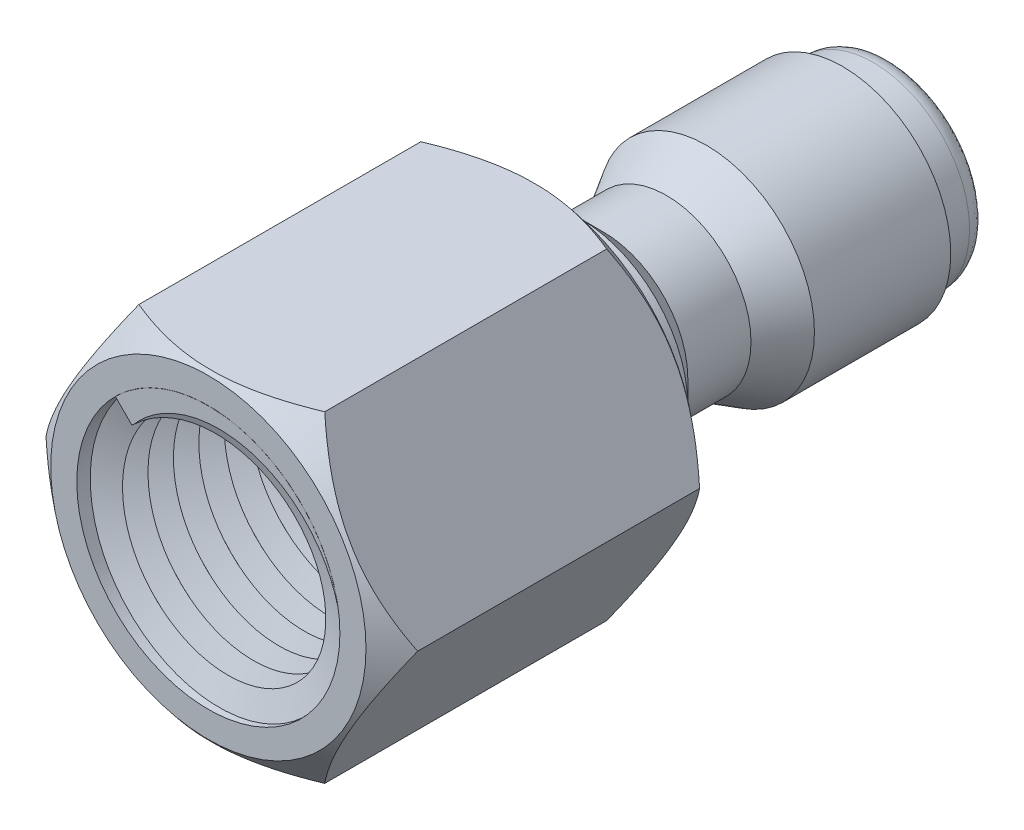
from build123d import *

# Parameters (mm, degrees)
BOSS_EXTRUDE1_DEPTH = 17.78
SKETCH2_R           = 5.842
BOSS_EXTRUDE2_DEPTH = 19.05
SKETCH4_R           = 3.175
CUT_EXTRUDE1_DEPTH  = 40.154036836
SKETCH6_R           = 7.112
CUT_EXTRUDE2_DEPTH  = 16.51
CHAMFER2_SIZE       = 2.286
SWEEP1_PITCH        = 1.375833333
FILLET2_SIZE        = 0.635
FILLET2_SIZE_2      = 0.889


with BuildPart() as part:
    # Sketch1 → Boss-Extrude1 (new body)
    with BuildSketch(Plane.XY):
        Polygon((10.045317334, 0), (5.022658667, 8.6995), (-5.022658667, 8.6995), (-10.045317334, 0), (-5.022658667, -8.6995), (5.022658667, -8.6995), align=None)
    extrude(amount=BOSS_EXTRUDE1_DEPTH)

    # Sketch2 → Boss-Extrude2 (add)
    with BuildSketch(Plane.XY):
        Circle(SKETCH2_R)
    extrude(amount=-BOSS_EXTRUDE2_DEPTH)

    # Sketch4 → Cut-Extrude1 (cut, through all)
    with BuildSketch(Plane(origin=(0, 0, -19.05), x_dir=(-1, 0, 0), z_dir=(0, 0, -1))):
        Circle(SKETCH4_R)
    extrude(amount=-CUT_EXTRUDE1_DEPTH, mode=Mode.SUBTRACT)

    # Sketch6 → Cut-Extrude2 (cut)
    with BuildSketch(Plane.XY.offset(17.78)):
        Circle(SKETCH6_R)
    extrude(amount=-CUT_EXTRUDE2_DEPTH, mode=Mode.SUBTRACT)

    # Chamfer2
    chamfer2_edges = [part.edges().sort_by_distance(p)[0] for p in [
        (3.175, 0, 1.27),
    ]]
    chamfer(chamfer2_edges, length=CHAMFER2_SIZE)

    # Sweep1: the profile of Sketch8 screwed along a right-hand helix of 12 turns, 8 arcs to a turn; built about Z, then put on its axis
    sweep1_z = Axis((0, 0, 0), (0, 0, 1))
    sweep1_corners = [(7.104477613, -0.014504235, 0.471086458), (5.834477613, 0.000131746, -0.004279005), (7.104477613, 0.014767727, -0.479644467)]
    with BuildLine(mode=Mode.PRIVATE) as sweep1_profile:
        Line(sweep1_corners[0], sweep1_corners[1])
        Line(sweep1_corners[1], sweep1_corners[2])
        Line(sweep1_corners[2], sweep1_corners[0])
    sweep1_cap = Face(sweep1_profile.wire())
    sweep1_turn_angles = [0, 22.5, 45, 67.5, 90, 112.5, 135, 157.5, 180, 202.5, 225, 247.5, 270, 292.5, 315, 337.5, 360]
    sweep1_turn_weights = [1, 0.9238795325112867, 1, 0.9238795325112867, 1, 0.9238795325112867, 1, 0.9238795325112867, 1, 0.9238795325112867, 1, 0.9238795325112867, 1, 0.9238795325112867, 1, 0.9238795325112867, 1]
    sweep1_turn_rails = [Edge.make_bspline([Vector(p[0], p[1], 0).rotate(sweep1_z, sweep1_turn_angles[k]) / sweep1_turn_weights[k] + Vector(0, 0, p[2] + SWEEP1_PITCH * sweep1_turn_angles[k] / 360) for k in range(17)], [0, 0, 0, 1, 1, 2, 2, 3, 3, 4, 4, 5, 5, 6, 6, 7, 7, 8, 8, 8], 2, sweep1_turn_weights) for p in sweep1_corners]
    sweep1_turn_sides = [Face.make_surface_from_curves(sweep1_turn_rails[p[0]], sweep1_turn_rails[p[1]]) for p in [(0, 1), (1, 2), (2, 0)]]
    sweep1 = Plane(origin=(0, 0, 17.78), x_dir=(-0.7071067811865512, 0.7071067811865438, 0), z_dir=(0, 0, -1)) * Solid(Shell([*[p.moved(Location((0, 0, SWEEP1_PITCH * i))) for i in range(12) for p in sweep1_turn_sides], sweep1_cap, sweep1_cap.rotate(sweep1_z, 4320).moved(Location((0, 0, SWEEP1_PITCH * 4320 / 360)))]))
    add(sweep1)

    # Sketch3 → Cut-Revolve1 (revolve, cut)
    with BuildSketch(Plane(origin=(0, 0, 0), x_dir=(1, 0, 0), z_dir=(0, 1, 0))):
        Polygon((5.842, 2.29529318), (4.572, 3.56529318), (4.572, 6.982147686), (5.842, 9.141147686), (7.024082577, 9.141147686), (7.024082577, 2.29529318), align=None)
        Polygon((5.207, 16.891), (5.207, 19.05), (5.207, 21.80787249), (6.770928995, 21.80787249), (6.770928995, 16.111887573), (5.842, 16.51), align=None)
        Polygon((8.521317334, 0), (10.045317334, -1.27), (11.090056236, -1.27), (11.090056236, 0.929928927), (8.521317334, 0.929928927), align=None)
        Polygon((10.045317334, -16.51), (8.521317334, -17.78), (2.976970863, -17.78), (2.976970863, -18.538277006), (8.521317334, -18.538277006), (10.597280987, -18.538277006), (10.597280987, -16.51), align=None)
    revolve(axis=Axis((0, 0, 0), (0, 0, -1)), mode=Mode.SUBTRACT)

    # Fillet2
    # an asymmetric fillet: 0.889, 0.635 mm, written as the material it takes off along each edge
    with BuildSketch(Plane(origin=(0, 0, -19.05), x_dir=(1, 0, 0), z_dir=(0, 1, 0))) as fillet2_piece_1:
        with BuildLine():
            Bezier((5.207 - FILLET2_SIZE, 0), (5.207, 0), (5.207, -FILLET2_SIZE_2), weights=[1, 0.707106781, 1])
            Line((5.207, -FILLET2_SIZE_2), (5.207, 0))
            Line((5.207, 0), (5.207 - FILLET2_SIZE, 0))
        make_face()
    revolve(axis=Axis((0, 0, -19.05), (0, 0, -1)), mode=Mode.SUBTRACT)


solid = part.part
